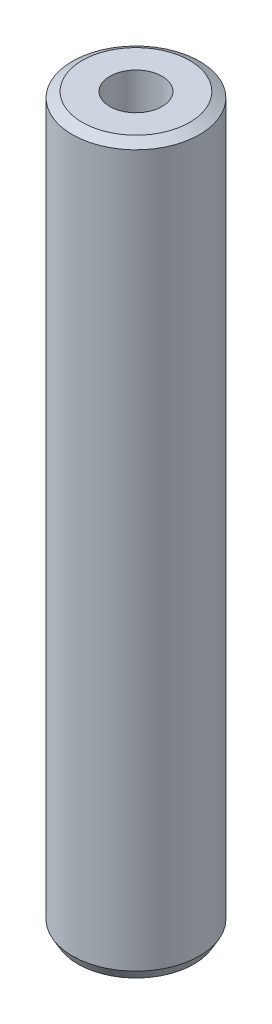
from build123d import *
from OCP.BRepFilletAPI import BRepFilletAPI_MakeChamfer

# Parameters (mm, degrees)
SKETCH1_R           = 52.5
BOSS_EXTRUDE1_DEPTH = 600
SKETCH2_R           = 21.60809678
CUT_EXTRUDE1_DEPTH  = 605.576297914
CHAMFER1_SIZE       = 4.65642078
CHAMFER1_SIZE2      = 8.184660025


with BuildPart() as part:
    # Sketch1 → Boss-Extrude1 (new body)
    with BuildSketch(Plane(origin=(0, 0, 0), x_dir=(1, 0, 0), z_dir=(0, 1, 0))):
        Circle(SKETCH1_R)
    extrude(amount=BOSS_EXTRUDE1_DEPTH)

    # Sketch2 → Cut-Extrude1 (cut, through all)
    with BuildSketch(Plane(origin=(0, 0, 0), x_dir=(1, 0, 0), z_dir=(0, 1, 0))):
        Circle(SKETCH2_R)
    extrude(amount=CUT_EXTRUDE1_DEPTH, mode=Mode.SUBTRACT)

    # Chamfer1: one chamfer whose edges measure the first distance from different faces: ONE call of the kernel's chamfer builder (chamfer() names one face for all edges)
    chamfer1_edges_1 = [part.edges().sort_by_distance(p)[0] for p in [
        (-52.5, 600, 0),
    ]]
    chamfer1_side_1 = [part.faces().sort_by_distance(p)[0] for p in [
        (-52.5, 300, 0),
    ]]
    chamfer1_edges_2 = [part.edges().sort_by_distance(p)[0] for p in [
        (-52.5, 0, 0),
    ]]
    chamfer1_side_2 = [part.faces().sort_by_distance(p)[0] for p in [
        (-51.01507576, 0, 0),
    ]]
    chamfer1 = BRepFilletAPI_MakeChamfer(part.part.solid().wrapped)
    for e in chamfer1_edges_1:
        chamfer1.Add(CHAMFER1_SIZE, CHAMFER1_SIZE2, e.wrapped, chamfer1_side_1[0].wrapped)  # the first distance lies on this face
    for e in chamfer1_edges_2:
        chamfer1.Add(CHAMFER1_SIZE, CHAMFER1_SIZE2, e.wrapped, chamfer1_side_2[0].wrapped)  # the first distance lies on this face
    add(Compound.cast(chamfer1.Shape()), mode=Mode.REPLACE)


solid = part.part
